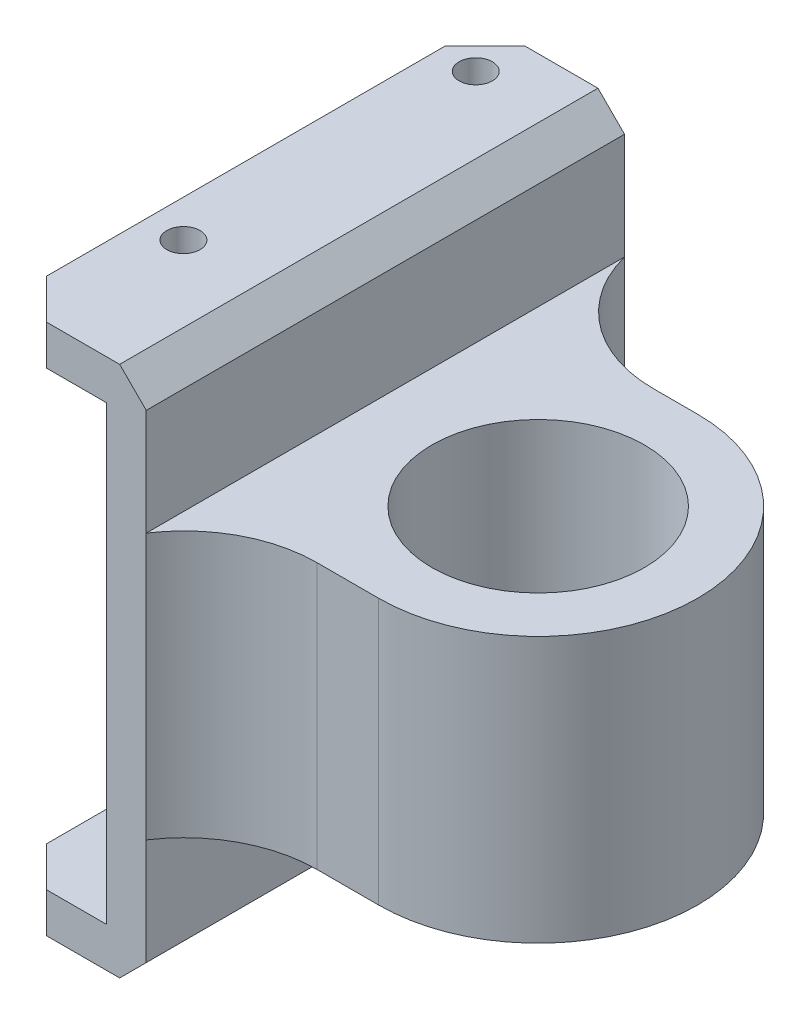
from build123d import *

# Parameters (mm, degrees)
BOSS_EXTRUDE1_DEPTH = 36
SKETCH2_R           = 1.25
CUT_EXTRUDE1_DEPTH  = 55.829280499
CHAMFER1_SIZE       = 3
SKETCH4_R           = 8
BOSS_EXTRUDE2_DEPTH = 40
FILLET1_R           = 10
SKETCH5_W           = 25
SKETCH5_H           = 10
CUT_EXTRUDE3_DEPTH  = 49.176757882
CHAMFER2_SIZE       = 2


with BuildPart() as part:
    # Sketch1 → Boss-Extrude1 (new body)
    with BuildSketch(Plane.XY):
        Polygon((-10.5, 17), (-3, 17), (-3, -17), (-10.5, -17), (-10.5, -20), (0, -20), (0, 20), (-10.5, 20), align=None)
    extrude(amount=BOSS_EXTRUDE1_DEPTH)

    # Sketch2 → Cut-Extrude1 (cut, through all)
    with BuildSketch(Plane(origin=(0, 20, 0), x_dir=(1, 0, 0), z_dir=(0, 1, 0))):
        with Locations(Location((-7.7, -3.5, 0), (0, 0, 270))):
            Circle(SKETCH2_R)
        with Locations(Location((-7.7, -25.5, 0), (0, 0, 270))):
            Circle(SKETCH2_R)
    extrude(amount=-CUT_EXTRUDE1_DEPTH, mode=Mode.SUBTRACT)

    # Chamfer1
    chamfer1_edges = [part.edges().sort_by_distance(p)[0] for p in [
        (-10.5, 18.5, 0),
        (-10.5, -18.5, 36),
        (-10.5, 18.5, 36),
        (-10.5, -18.5, 0),
    ]]
    chamfer(chamfer1_edges, length=CHAMFER1_SIZE)

    # Sketch4 → Boss-Extrude2 (add, through all)
    with BuildSketch(Plane(origin=(0, 20, 0), x_dir=(1, 0, 0), z_dir=(0, 1, 0))):
        with BuildLine():
            Line((13, -7.5), (0, -7.5))
            Line((0, -7.5), (0, -31.5))
            Line((0, -31.5), (13, -31.5))
            ThreePointArc((13, -31.5), (25, -19.5), (13, -7.5))
        make_face()
        with Locations(Location((13, -19.5, 0), (0, 0, 270))):
            Circle(SKETCH4_R, mode=Mode.SUBTRACT)
    extrude(amount=-BOSS_EXTRUDE2_DEPTH)

    # Fillet1
    # the kernel refuses this fillet: 10 mm, written as the material it adds along each edge
    with BuildSketch(Plane(origin=(0, 20, 7.5), x_dir=(0, 0, -1), z_dir=(0, -1, 0))) as fillet1_piece_1:
        with BuildLine():
            CenterArc((10, 9.682458366), FILLET1_R, 180, 75.522487814)
            Line((0, 9.682458366), (-0.2, 9.682458366))
            Line((-0.2, 9.682458366), (-0.2, 0))
            Line((-0.2, 0), (0, -0.2))
            ThreePointArc((0, -0.2), (3.75, -0.2), (7.45, -0.193649167))
            Line((7.45, -0.193649167), (7.5, 0))
        make_face()
    extrude(amount=40)
    with BuildSketch(Plane(origin=(0, 20, 31.5), x_dir=(1.5375725384245926e-12, 0, 1.0), z_dir=(0, -1, 0))) as fillet1_piece_2:
        with BuildLine():
            CenterArc((10, -8.351646544), FILLET1_R, 123.367012969, 56.632987031)
            Line((0, -8.351646544), (-0.2, -8.351646544))
            Line((-0.2, -8.351646544), (-0.2, 0))
            Line((-0.2, 0), (0, 0.2))
            ThreePointArc((0, 0.2), (2.25, 0.2), (4.39, 0.167032931))
            Line((4.39, 0.167032931), (4.5, 0))
        make_face()
    extrude(amount=40)

    # Sketch5 → Cut-Extrude3 (cut, through all)
    with BuildSketch(Plane.XY.offset(36)):
        with Locations((12.5, 15)):
            Rectangle(SKETCH5_W, SKETCH5_H)
        with Locations((12.5, -15)):
            Rectangle(SKETCH5_W, SKETCH5_H)
    extrude(amount=-CUT_EXTRUDE3_DEPTH, mode=Mode.SUBTRACT)

    # Chamfer2
    chamfer2_edges = [part.edges().sort_by_distance(p)[0] for p in [
        (0, 20, 18),
        (0, -20, 18),
    ]]
    chamfer(chamfer2_edges, length=CHAMFER2_SIZE)


solid = part.part
